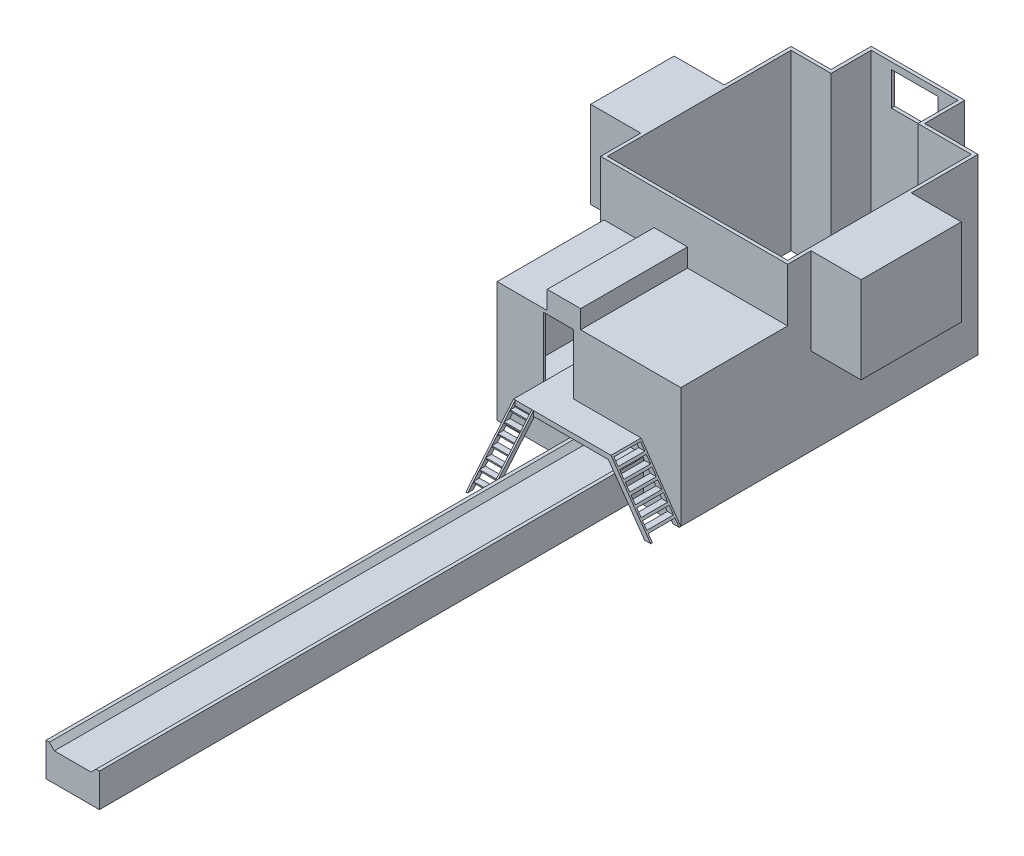
from build123d import *

# Parameters (mm, degrees)
SALIENTE_EXTRUIR1_DEPTH = 5200
CROQUIS2_W              = 5500
CROQUIS2_H              = 1600
CORTAR_EXTRUIR1_DEPTH   = 3200
CROQUIS3_W              = 2500
CROQUIS3_H              = 2600
CORTAR_EXTRUIR2_DEPTH   = 1500
CROQUIS4_W              = 3000
CROQUIS4_H              = 2600
CORTAR_EXTRUIR3_DEPTH   = 1500
SALIENTE_EXTRUIR2_DEPTH = 900
CORTAR_EXTRUIR4_START   = -5500
CROQUIS6_W              = 800
CROQUIS6_H              = 180
CORTAR_EXTRUIR4_DEPTH   = 5500
CORTAR_EXTRUIR5_START   = -5331.950191
CROQUIS7_W              = 800
CROQUIS7_H              = 185
CORTAR_EXTRUIR5_DEPTH   = 5163.900382
CROQUIS8_W              = 900
CROQUIS8_H              = 1800
CORTAR_EXTRUIR6_DEPTH   = 3200
CROQUIS9_W              = 5398.4
CROQUIS9_H              = 3097.6
CORTAR_EXTRUIR7_DEPTH   = 3500
SALIENTE_EXTRUIR3_REACH = 14041.287
CROQUIS10_W             = 900
CROQUIS10_H             = 100
CROQUIS11_W             = 2200
CROQUIS11_H             = 1300
CORTAR_EXTRUIR8_DEPTH   = 3149.2
CROQUIS12_W             = 5398.4
CROQUIS12_H             = 1300
SALIENTE_EXTRUIR4_DEPTH = 1000
CROQUIS13_W             = 1100
CROQUIS13_H             = 1300
SALIENTE_EXTRUIR5_DEPTH = 1000
CROQUIS14_W             = 1600
CROQUIS14_H             = 1000
SALIENTE_EXTRUIR6_DEPTH = 16600
CORTAR_EXTRUIR13_DEPTH  = 16600
CHAFL_N1_SIZE           = 150
CORTAR_EXTRUIR14_DEPTH  = 5400
CROQUIS22_W             = 1000
CROQUIS22_H             = 550
SALIENTE_EXTRUIR7_DEPTH = 3200
CROQUIS23_W             = 1390.352814956
CROQUIS23_H             = 1700
CORTAR_EXTRUIR15_DEPTH  = 900
SALIENTE_EXTRUIR8_DEPTH = 600
CORTAR_EXTRUIR16_REACH  = 17859.16
CROQUIS25_W             = 498.4
CROQUIS25_H             = 1426.469373001
CROQUIS26_W             = 151.037933612
CROQUIS26_H             = 38.1
CROQUIS26_W_2           = 175
SALIENTE_EXTRUIR9_DEPTH = 549.2
CORTAR_EXTRUIR17_DEPTH  = 100


with BuildPart() as part:
    # Croquis1 → Saliente-Extruir1 (new body)
    with BuildSketch(Plane(origin=(0, 0, 0), x_dir=(1, 0, 0), z_dir=(0, 1, 0))):
        Polygon((0, 0), (0, 3200), (-100, 3200), (-100, 4400), (-1600, 4400), (-1600, 6900), (-100, 6900), (-100, 8900), (500, 8900), (1100, 8900), (1100, 10102.7991465), (3900, 10102.7991465), (3900, 8900), (5500, 8900), (5500, 6900), (7000, 6900), (7000, 3900), (5500, 3900), (5500, 0), align=None)
    extrude(amount=SALIENTE_EXTRUIR1_DEPTH)

    # Croquis2 → Cortar-Extruir1 (cut)
    with BuildSketch(Plane.XY):
        with Locations((2750, 4400)):
            Rectangle(CROQUIS2_W, CROQUIS2_H)
    extrude(amount=-CORTAR_EXTRUIR1_DEPTH, mode=Mode.SUBTRACT)

    # Croquis3 → Cortar-Extruir2 (cut)
    with BuildSketch(Plane.ZY.offset(1600)):
        with Locations((-5650, 1300)):
            Rectangle(CROQUIS3_W, CROQUIS3_H)
    extrude(amount=-CORTAR_EXTRUIR2_DEPTH, mode=Mode.SUBTRACT)

    # Croquis4 → Cortar-Extruir3 (cut)
    with BuildSketch(Plane(origin=(7000, 0, 0), x_dir=(0, 0, -1), z_dir=(1, 0, 0))):
        with Locations((5400, 1300)):
            Rectangle(CROQUIS4_W, CROQUIS4_H)
    extrude(amount=-CORTAR_EXTRUIR3_DEPTH, mode=Mode.SUBTRACT)

    # Croquis5 → Saliente-Extruir2 (add)
    with BuildSketch(Plane.XY):
        Polygon((0, 0), (1190.352814956, 1700), (4309.647185043, 1700), (5500, 0), (5316.883811686, 0), (4231.562127461, 1550), (1268.437872539, 1550), (183.116188314, 0), align=None)
    extrude(amount=SALIENTE_EXTRUIR2_DEPTH)

    # Croquis6 → Cortar-Extruir4 (cut)
    with BuildSketch(Plane.ZY.offset(CORTAR_EXTRUIR4_START)):
        with Locations((450, 90)):
            Rectangle(CROQUIS6_W, CROQUIS6_H)
    extrude(amount=CORTAR_EXTRUIR4_DEPTH, mode=Mode.SUBTRACT)

    # Croquis7 → Cortar-Extruir5 (cut)
    with BuildSketch(Plane.ZY.offset(CORTAR_EXTRUIR5_START)):
        with Locations((450, 332.5)):
            Rectangle(CROQUIS7_W, CROQUIS7_H)
        with Locations((450, 577.5)):
            Rectangle(CROQUIS7_W, CROQUIS7_H)
        with Locations((450, 822.5)):
            Rectangle(CROQUIS7_W, CROQUIS7_H)
        with Locations((450, 1067.5)):
            Rectangle(CROQUIS7_W, CROQUIS7_H)
        with Locations((450, 1312.5)):
            Rectangle(CROQUIS7_W, CROQUIS7_H)
        with Locations((450, 1557.5)):
            Rectangle(CROQUIS7_W, CROQUIS7_H)
    extrude(amount=CORTAR_EXTRUIR5_DEPTH, mode=Mode.SUBTRACT)

    # Croquis8 → Cortar-Extruir6 (cut)
    with BuildSketch(Plane.XY):
        with Locations((1840.352814956, 2600)):
            Rectangle(CROQUIS8_W, CROQUIS8_H)
    extrude(amount=-CORTAR_EXTRUIR6_DEPTH, mode=Mode.SUBTRACT)

    # Croquis9 → Cortar-Extruir7 (cut)
    with BuildSketch(Plane.XZ):
        with Locations((2750, -1600.4)):
            Rectangle(CROQUIS9_W, CROQUIS9_H)
    extrude(amount=-CORTAR_EXTRUIR7_DEPTH, mode=Mode.SUBTRACT)

    # Saliente-Extruir3: up to this face of the body (flat: up to its plane)
    saliente_extruir3_end = Plane(part.part.faces().sort_by_distance((2835.307069407, 1670.286666975, -3149.2))[0])
    # Croquis10 → Saliente-Extruir3 (add, up to the picked face)
    with BuildSketch(Plane.XY.offset(900), mode=Mode.PRIVATE) as saliente_extruir3_sk1:
        with Locations((1840.352814956, 1650)):
            Rectangle(CROQUIS10_W, CROQUIS10_H)
    saliente_extruir3_tool1 = split(extrude(saliente_extruir3_sk1.sketch, amount=-SALIENTE_EXTRUIR3_REACH, mode=Mode.PRIVATE), bisect_by=saliente_extruir3_end, keep=Keep.BOTH, mode=Mode.PRIVATE)
    add(saliente_extruir3_tool1.solids().sort_by(Axis((1840.352815, 1650, 900), (0, 0, -1)))[0])

    # Croquis11 → Cortar-Extruir8 (cut)
    with BuildSketch(Plane.XY):
        with Locations((3290, 650)):
            Rectangle(CROQUIS11_W, CROQUIS11_H)
    extrude(amount=-CORTAR_EXTRUIR8_DEPTH, mode=Mode.SUBTRACT)

    # Croquis12 → Saliente-Extruir4 (add)
    with BuildSketch(Plane.XZ):
        with Locations((2750, -1199.2)):
            Rectangle(CROQUIS12_W, CROQUIS12_H)
    extrude(amount=-SALIENTE_EXTRUIR4_DEPTH)

    # Croquis13 → Saliente-Extruir5 (add)
    with BuildSketch(Plane.XZ):
        with Locations((600.8, -2499.2)):
            Rectangle(CROQUIS13_W, CROQUIS13_H)
        with Locations((4899.2, -2499.2)):
            Rectangle(CROQUIS13_W, CROQUIS13_H)
    extrude(amount=-SALIENTE_EXTRUIR5_DEPTH)

    # Croquis14 → Saliente-Extruir6 (add)
    with BuildSketch(Plane.XY.offset(-549.2)):
        with Locations((3340, 500)):
            Rectangle(CROQUIS14_W, CROQUIS14_H)
    extrude(amount=SALIENTE_EXTRUIR6_DEPTH)

    # Croquis18 → Cortar-Extruir13 (cut)
    with BuildSketch(Plane.XY.offset(16050.8)):
        Polygon((2640, 1000), (2790, 850), (3890, 850), (4040, 1000), align=None)
    extrude(amount=-CORTAR_EXTRUIR13_DEPTH, mode=Mode.SUBTRACT)

    # Chaflán1
    chafl_n1_edges = [part.edges().sort_by_distance(p)[0] for p in [
        (3340, 1000, -549.2),
    ]]
    chamfer(chafl_n1_edges, length=CHAFL_N1_SIZE - 0.0001)  # a hair under: the kernel refuses the full size

    # Croquis21 → Cortar-Extruir14 (cut)
    with BuildSketch(Plane.XZ):
        Polygon((3800, -10002.7991465), (1200, -10002.7991465), (1200, -8800), (0, -8800), (0, -3300), (5400, -3300), (5400, -8800), (3800, -8800), align=None)
    extrude(amount=-CORTAR_EXTRUIR14_DEPTH, mode=Mode.SUBTRACT)

    # Croquis22 → Saliente-Extruir7 (add)
    with BuildSketch(Plane.XY):
        with Locations((2000, 3875)):
            Rectangle(CROQUIS22_W, CROQUIS22_H)
    extrude(amount=-SALIENTE_EXTRUIR7_DEPTH)

    # Croquis23 → Cortar-Extruir15 (cut)
    with BuildSketch(Plane.XY.offset(900)):
        with Locations((695.176407478, 850)):
            Rectangle(CROQUIS23_W, CROQUIS23_H)
    extrude(amount=-CORTAR_EXTRUIR15_DEPTH, mode=Mode.SUBTRACT)

    # Croquis24 → Saliente-Extruir8 (add)
    with BuildSketch(Plane.ZY.offset(-1390.352814956)):
        Polygon((900, 1700), (2326.469373001, 0), (2160.682647256, 0), (900, 1502.423073989), align=None)
    extrude(amount=-SALIENTE_EXTRUIR8_DEPTH)

    # Cortar-Extruir16: up to this face of the body (flat: up to its plane)
    cortar_extruir16_end = Plane(part.part.faces().sort_by_distance((5408.441905843, 0, 875))[0])
    # Croquis25 → Cortar-Extruir16 (cut, up to the picked face)
    with BuildSketch(Plane(origin=(0, 1700, 0), x_dir=(1, 0, 0), z_dir=(0, 1, 0)), mode=Mode.PRIVATE) as cortar_extruir16_sk1:
        with Locations((1690.352814956, -1613.234686501)):
            Rectangle(CROQUIS25_W, CROQUIS25_H)
    cortar_extruir16_tool1 = split(extrude(cortar_extruir16_sk1.sketch, amount=-CORTAR_EXTRUIR16_REACH, mode=Mode.PRIVATE), bisect_by=cortar_extruir16_end, keep=Keep.BOTH, mode=Mode.PRIVATE)
    add(cortar_extruir16_tool1.solids().sort_by(Axis((1690.352815, 1700, 1613.234687), (0, -1, 0)))[0], mode=Mode.SUBTRACT)

    # Croquis26 → Saliente-Extruir9 (add)
    with BuildSketch(Plane.ZY.offset(-1390.352814956)):
        with Locations((975.518966806, 1500.95)):
            Rectangle(CROQUIS26_W, CROQUIS26_H)
        with Locations((1146.545563172, 1282.85)):
            Rectangle(CROQUIS26_W_2, CROQUIS26_H)
        with Locations((1329.553192731, 1064.75)):
            Rectangle(CROQUIS26_W_2, CROQUIS26_H)
        with Locations((1512.560822291, 846.65)):
            Rectangle(CROQUIS26_W_2, CROQUIS26_H)
        with Locations((1695.568451851, 628.55)):
            Rectangle(CROQUIS26_W_2, CROQUIS26_H)
        with Locations((1878.576081411, 410.45)):
            Rectangle(CROQUIS26_W_2, CROQUIS26_H)
        with Locations((2061.583710971, 192.35)):
            Rectangle(CROQUIS26_W_2, CROQUIS26_H)
    extrude(amount=-SALIENTE_EXTRUIR9_DEPTH)

    # Croquis27 → Cortar-Extruir17 (cut)
    with BuildSketch(Plane(origin=(0, 0, -10102.7991465), x_dir=(-1, 0, 0), z_dir=(0, 0, -1))):
        Polygon((-2500, 4000), (-3200, 4000), (-3200, 5000), (-1800, 5000), (-1800, 4000), align=None)
    extrude(amount=-CORTAR_EXTRUIR17_DEPTH, mode=Mode.SUBTRACT)


solid = part.part
